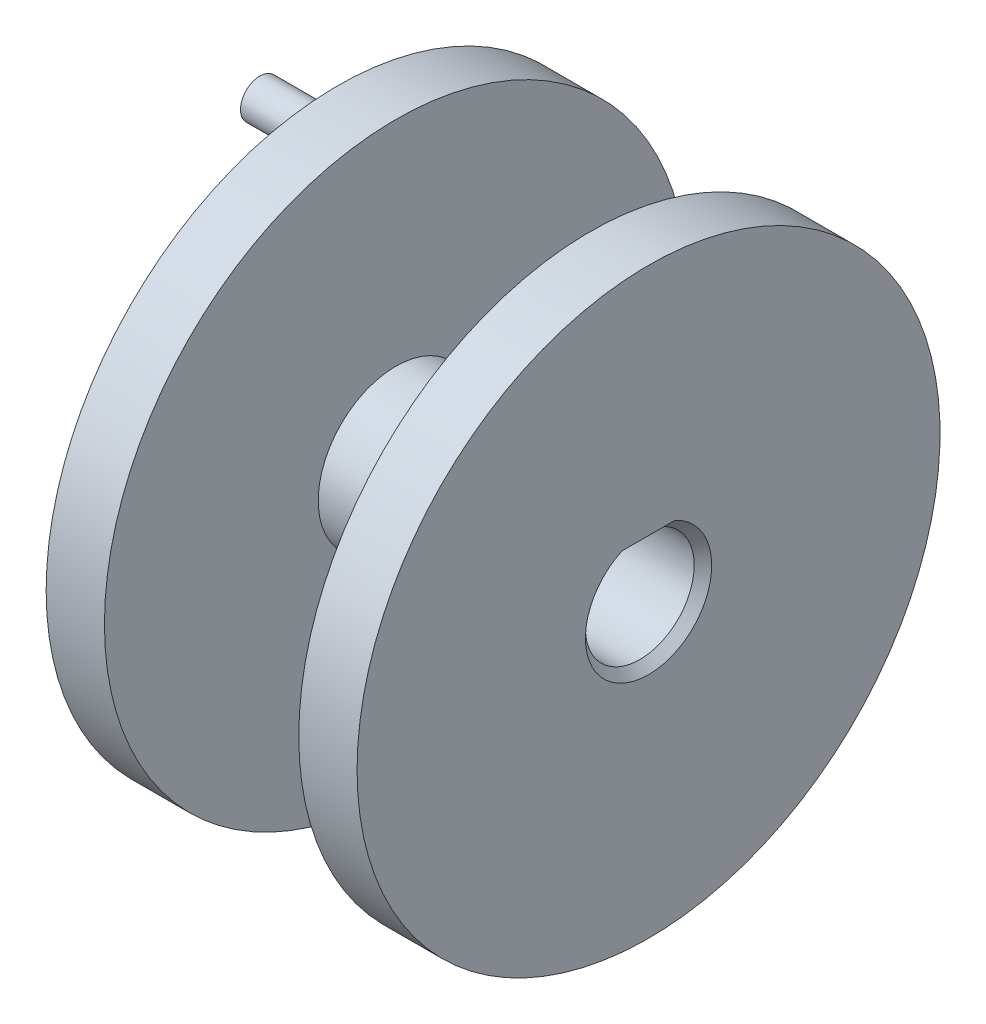
from build123d import *

# Parameters (mm, degrees)
SKETCH1_R                    = 4
FEMALE_SHAFT_DEPTH           = 5
SKETCH6_W                    = 3
SKETCH6_H                    = 15
MALE_SHAFT_INSERT_DEPTH      = 23.671568098
MALE_SHAFT_INSERT_DEPTH_BACK = 23.671568098
CHAMFER1_SIZE                = 0.45
SKETCH7_R                    = 1
BOSS_EXTRUDE1_DEPTH          = 4


with BuildPart() as part:
    # Sketch1 → Female Shaft (new, symmetric)
    with BuildSketch(Plane(origin=(0, 0, 0), x_dir=(0, 0, -1), z_dir=(1, 0, 0))):
        Circle(SKETCH1_R)
        with BuildLine():
            Line((-1.260952021, 2.5), (1.260952021, 2.5))
            ThreePointArc((1.260952021, 2.5), (0, -2.8), (-1.260952021, 2.5))
        make_face(mode=Mode.SUBTRACT)
    extrude(amount=FEMALE_SHAFT_DEPTH, both=True)

    # Sketch6 → Spool Edge (revolve)
    with BuildSketch(Plane.XY):
        with Locations((6.5, 7.5)):
            Rectangle(SKETCH6_W, SKETCH6_H)
    spool_edge = revolve(axis=Axis((0, 0, 0), (1, 0, 0)))

    # Spool Edge Mirror: Spool Edge across plane
    add(spool_edge.mirror(Plane(origin=(0, 0, 0), x_dir=(0, 0, 1), z_dir=(1, 0, 0))))

    # Sketch1<3> → Male Shaft Insert (cut, two sides: drawn at the far end of the back side and taken through both)
    with BuildSketch(Plane(origin=(0, 0, 0), x_dir=(0, 0, -1), z_dir=(1, 0, 0)).offset(-MALE_SHAFT_INSERT_DEPTH_BACK)):
        with BuildLine():
            Line((1.260952021, 2.5), (-1.260952021, 2.5))
            ThreePointArc((-1.260952021, 2.5), (0, -2.8), (1.260952021, 2.5))
        make_face()
    extrude(amount=MALE_SHAFT_INSERT_DEPTH + MALE_SHAFT_INSERT_DEPTH_BACK, mode=Mode.SUBTRACT)

    # Chamfer1
    chamfer1_edges = [part.edges().sort_by_distance(p)[0] for p in [
        (8, -2.8, 0),
        (8, 2.5, 0),
    ]]
    chamfer(chamfer1_edges, length=CHAMFER1_SIZE)

    # Sketch7 → Boss-Extrude1 (add)
    with BuildSketch(Plane.ZY.offset(8)):
        with Locations((0, 12.433518361)):
            Circle(SKETCH7_R)
    extrude(amount=BOSS_EXTRUDE1_DEPTH)


solid = part.part
